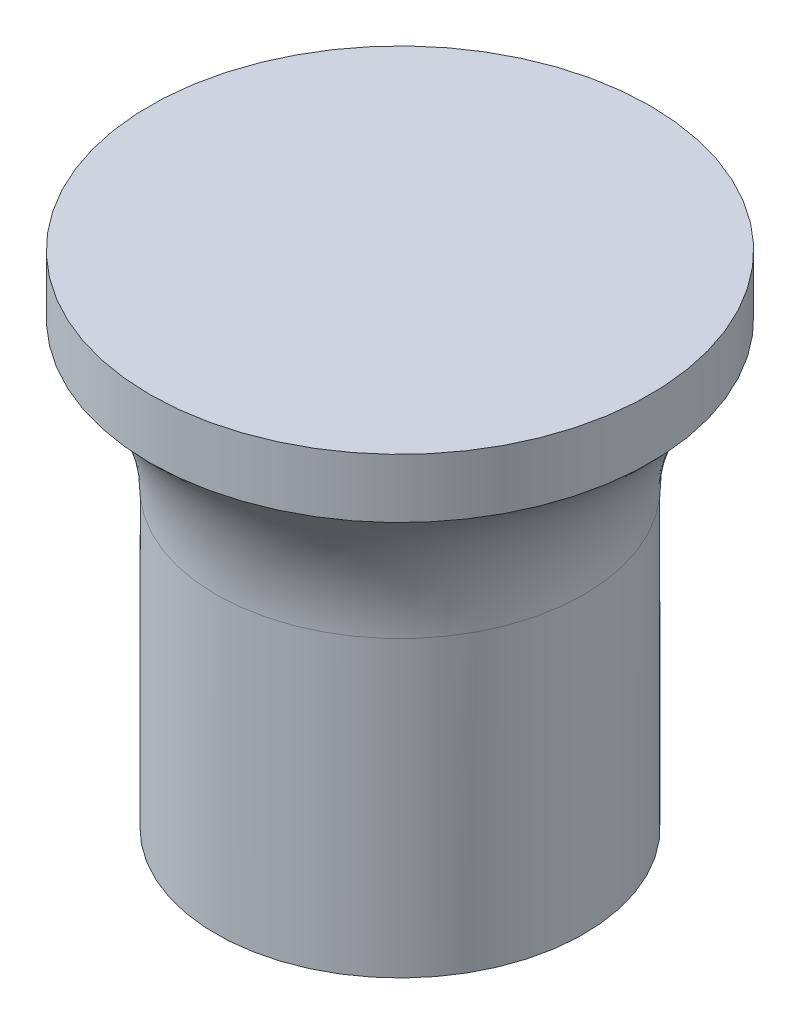
from build123d import *

# Parameters (mm, degrees)
SKETCH1_R           = 12.699999999999998
BOSS_EXTRUDE1_DEPTH = 25.4
SKETCH2_R           = 6.34
CUT_EXTRUDE1_DEPTH  = 22.4
SKETCH3_R           = 12.7
SKETCH3_R_2         = 9.340000000000002
CUT_EXTRUDE4_DEPTH  = 22.4
FILLET1_R           = 10


with BuildPart() as part:
    # Sketch1 → Boss-Extrude1 (new body)
    with BuildSketch(Plane(origin=(0, 0, 0), x_dir=(1, 0, 0), z_dir=(0, 1, 0))):
        with Locations(Location((0, 0, 0), (0, 0, 270))):
            Circle(SKETCH1_R)
    extrude(amount=BOSS_EXTRUDE1_DEPTH)

    # Sketch2 → Cut-Extrude1 (cut)
    with BuildSketch(Plane.XZ):
        with Locations(Location((0, 0, 0), (0, 0, 270))):
            Circle(SKETCH2_R)
    extrude(amount=-CUT_EXTRUDE1_DEPTH, mode=Mode.SUBTRACT)

    # Sketch3 → Cut-Extrude4 (cut)
    with BuildSketch(Plane.XZ):
        with Locations(Location((0, 0, 0), (0, 0, 90))):
            Circle(SKETCH3_R)
        with Locations(Location((0, 0, 0), (0, 0, 270))):
            Circle(SKETCH3_R_2, mode=Mode.SUBTRACT)
    extrude(amount=-CUT_EXTRUDE4_DEPTH, mode=Mode.SUBTRACT)

    # Fillet1
    # the kernel refuses this fillet: 10 mm, written as the material it adds along each edge
    with BuildSketch(Plane(origin=(0, 22.4, 0), x_dir=(-1.8e-16, 0, -1), z_dir=(-1, 0, 1.8e-16))) as fillet1_piece_1:
        with BuildLine():
            CenterArc((19.340000000000003, 7.477325725150667), FILLET1_R, 180, 48.39434621608348)
            Line((9.340000000000003, 7.477325725150667), (9.140000000000004, 7.477325725150667))
            Line((9.140000000000004, 7.477325725150667), (9.140000000000002, 0))
            Line((9.140000000000002, 0), (9.340000000000002, -0.1999999999999993))
            ThreePointArc((9.340000000000002, -0.1999999999999993), (11.02, -0.1999999999999993), (12.5672, -0.1495465145030117))
            Line((12.5672, -0.1495465145030117), (12.7, 0))
        make_face()
    revolve(axis=Axis((0, 22.4, 0), (0, -1, 0)))
    # the kernel refuses this fillet: 10 mm, written as the material it takes off along each edge
    with BuildSketch(Plane(origin=(0, 0, 0), x_dir=(-1.8e-16, 0, -1), z_dir=(-1, 0, 1.8e-16))) as fillet1_2_piece_1:
        with BuildLine():
            CenterArc((16.339999999999996, -7.141428428542857), FILLET1_R, 134.42700400080568, 45.57299599919432)
            Line((6.339999999999996, -7.141428428542857), (6.139999999999996, -7.141428428542857))
            Line((6.139999999999996, -7.141428428542857), (6.14, 0))
            Line((6.14, 0), (6.34, 0.2))
            ThreePointArc((6.34, 0.2), (7.840000000000001, 0.2), (9.200000000000001, 0.14282856857085713))
            Line((9.200000000000001, 0.14282856857085713), (9.340000000000002, 0))
        make_face()
    revolve(axis=Axis((0, 0, 0), (0, -1, 0)), mode=Mode.SUBTRACT)


solid = part.part
